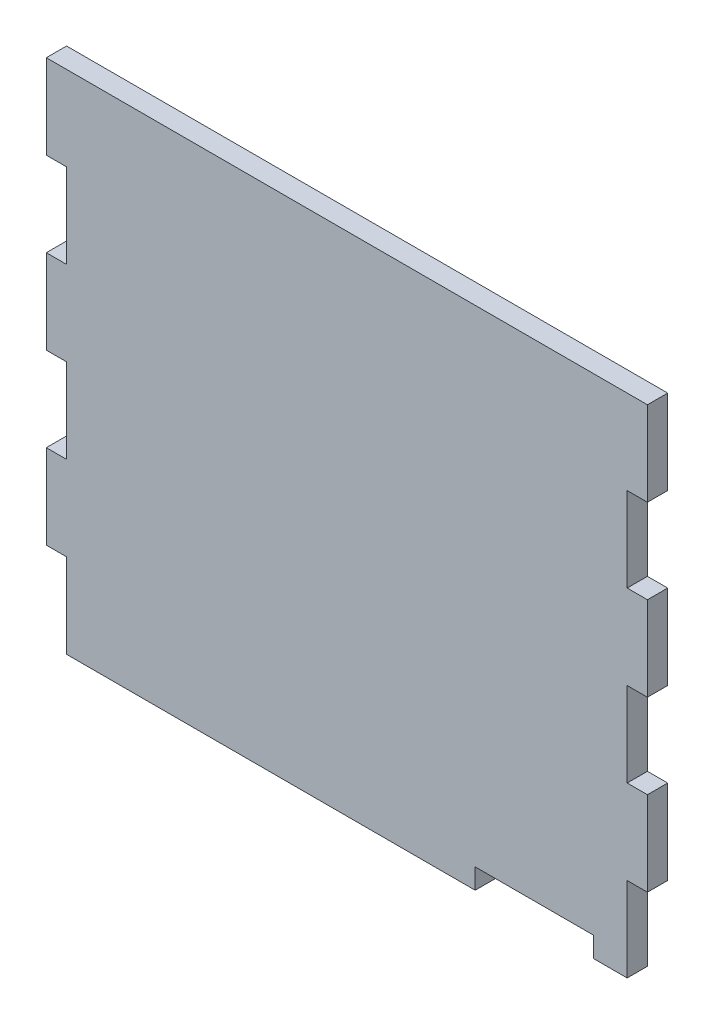
from build123d import *

# Parameters (mm, degrees)
SKETCH1_W            = 178
SKETCH1_H            = 150
BOSS_EXTRUDE1_DEPTH  = 6
SKETCH2_W            = 6
SKETCH2_H            = 25
CUT_EXTRUDE1_DEPTH   = 6
LPATTERN1_COUNT      = 3
LPATTERN1_PITCH      = 50
LPATTERN1_COUNT_DIR2 = 2
LPATTERN1_PITCH_DIR2 = 172
SKETCH3_W            = 35
SKETCH3_H            = 6
CUT_EXTRUDE2_DEPTH   = 233.851884253


with BuildPart() as part:
    # Sketch1 → Boss-Extrude1 (new body)
    with BuildSketch(Plane.XY):
        with Locations((-89, 75)):
            Rectangle(SKETCH1_W, SKETCH1_H)
    extrude(amount=BOSS_EXTRUDE1_DEPTH)

    # Sketch2 → Cut-Extrude1 (cut)
    with BuildSketch(Plane.XY.offset(6)):
        with Locations((-175, 112.5)):
            Rectangle(SKETCH2_W, SKETCH2_H)
    cut_extrude1 = extrude(amount=-CUT_EXTRUDE1_DEPTH, mode=Mode.SUBTRACT)

    # LPattern1: Cut-Extrude1 3 × 2
    with Locations(*[(j * LPATTERN1_PITCH_DIR2, -i * LPATTERN1_PITCH, 0) for i in range(LPATTERN1_COUNT) for j in range(LPATTERN1_COUNT_DIR2) if (i, j) != (0, 0)]):
        add(cut_extrude1, mode=Mode.SUBTRACT)

    # Sketch3 → Cut-Extrude2 (cut, through all)
    with BuildSketch(Plane.XY.offset(6)):
        with Locations((-33.5, 3)):
            Rectangle(SKETCH3_W, SKETCH3_H)
    extrude(amount=-CUT_EXTRUDE2_DEPTH, mode=Mode.SUBTRACT)


solid = part.part
